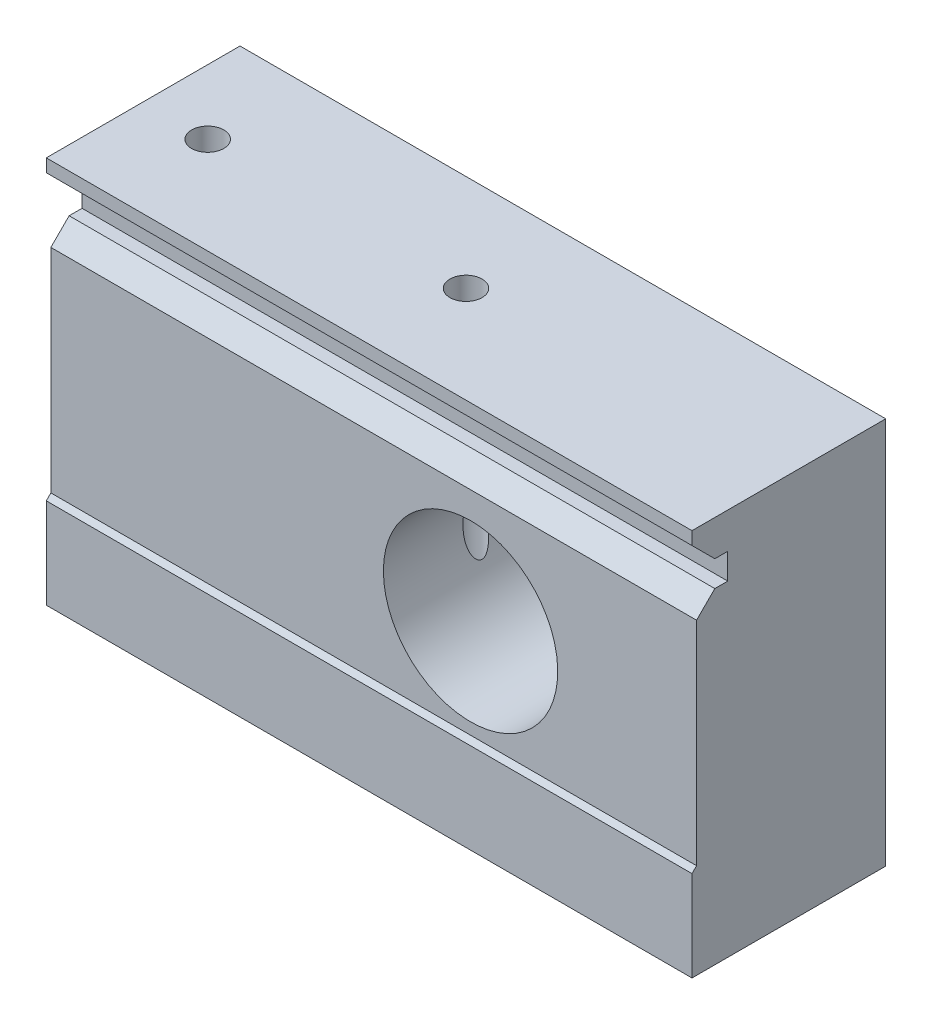
from build123d import *

# Parameters (mm, degrees)
SKETCH1_W              = 100
SKETCH1_H              = 60
BOSS_EXTRUDE1_DEPTH    = 30
CUT_EXTRUDE1_DEPTH     = 110
SKETCH_1_R             = 2.493332764
CUT_EXTRUDE_1_DEPTH    = 100
PATTERN_LINEAR_1_COUNT = 2
PATTERN_LINEAR_1_PITCH = 40
SKETCH_2_R             = 13.5
CUT_EXTRUDE_2_DEPTH    = 100


with BuildPart() as part:
    # Sketch1 → Boss-Extrude1 (new body)
    with BuildSketch(Plane.XY):
        with Locations((2.079207921, -0.485148515)):
            Rectangle(SKETCH1_W, SKETCH1_H)
    extrude(amount=BOSS_EXTRUDE1_DEPTH)

    # Sketch3 → Cut-Extrude1 (cut)
    with BuildSketch(Plane.ZY.offset(47.920792079)):
        Polygon((30, -30.485148515), (30, -16.485148515), (29.292893219, -15.778041734), (29.292893219, 17.150890454), (26.464466094, 19.979317579), (24.464466094, 19.979317579), (24.464466094, 23.979317579), (26.464466094, 23.979317579), (30, 27.514851485), (30, 29.514851485), (35.630972976, 28.601630178), (37.149112702, -26.247837132), align=None)
    extrude(amount=-CUT_EXTRUDE1_DEPTH, mode=Mode.SUBTRACT)

    # Эскиз1 → Вырез-Вытянуть1 (cut)
    with BuildSketch(Plane(origin=(0, 29.514851485, 0), x_dir=(1, 0, 0), z_dir=(0, 1, 0))):
        with Locations((2.079207921, -15)):
            Circle(SKETCH_1_R)
    cut_extrude_1 = extrude(amount=-CUT_EXTRUDE_1_DEPTH, mode=Mode.SUBTRACT)

    # Линейный массив1: Вырез-Вытянуть1 ×2
    with Locations(*[(-i * PATTERN_LINEAR_1_PITCH, 0, 0) for i in range(1, PATTERN_LINEAR_1_COUNT)]):
        add(cut_extrude_1, mode=Mode.SUBTRACT)

    # Эскиз2 → Вырез-Вытянуть2 (cut)
    with BuildSketch(Plane(origin=(0, 0, 0), x_dir=(-1, 0, 0), z_dir=(0, 0, -1))):
        with Locations((-17.079207921, -0.485148515)):
            Circle(SKETCH_2_R)
    extrude(amount=-CUT_EXTRUDE_2_DEPTH, mode=Mode.SUBTRACT)


solid = part.part
